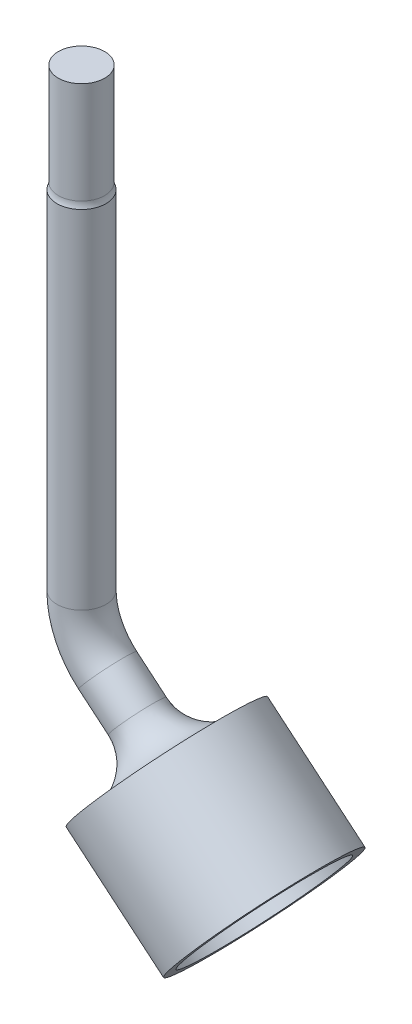
from build123d import *

# Parameters (mm, degrees)
SKETCH1_R           = 3.175
BOSS_EXTRUDE1_DEPTH = 40
SKETCH2_R           = 3.175
SKETCH5_R           = 11
BOSS_EXTRUDE2_DEPTH = 1.5
SKETCH4_R           = 11
SKETCH4_R_2         = 9.652
BOSS_EXTRUDE3_DEPTH = 15
SKETCH6_R           = 3
BOSS_EXTRUDE4_DEPTH = 14
FILLET1_R           = 2
FILLET2_R           = 5


with BuildPart() as part:
    # Sketch1 → Boss-Extrude1 (new body)
    with BuildSketch(Plane(origin=(0, 0, 0), x_dir=(1, 0, 0), z_dir=(0, 1, 0))):
        with Locations(Location((0, 0, 0), (0, 0, 270))):
            Circle(SKETCH1_R)
    extrude(amount=BOSS_EXTRUDE1_DEPTH)

    # Sweep1: sweep along a path in Sketch3
    with BuildLine(Plane.XY) as sweep1_path:
        Line((0, 0), (0, -5))
        ThreePointArc((0, -5), (0.892418328, -9.025438943), (3.402448018, -12.296573321))
        Line((3.402448018, -12.296573321), (11.062892449, -18.724449418))
    # Sketch2 → Sweep1 (sweep)
    with BuildSketch(Plane.XZ):
        Circle(SKETCH2_R)
    sweep(path=sweep1_path.line)

    # Sketch5 → Boss-Extrude2 (add)
    with BuildSketch(Plane(origin=(15.71196326, -13.183902576, 0), x_dir=(0, 0, -1), z_dir=(0.7660444431189796, -0.6427876096865375, 0))):
        with Locations(Location((0, -7.232670233, 0), (0, 0, 90))):
            Circle(SKETCH5_R)
    extrude(amount=BOSS_EXTRUDE2_DEPTH)

    # Sketch4 → Boss-Extrude3 (add)
    with BuildSketch(Plane(origin=(16.861029925, -14.148083991, 0), x_dir=(0, 0, -1), z_dir=(0.7660444431189796, -0.6427876096865375, 0))):
        with Locations(Location((0, -7.232670233, 0), (0, 0, 90))):
            Circle(SKETCH4_R)
        with Locations(Location((0, -7.232670233, 0), (0, 0, 90))):
            Circle(SKETCH4_R_2, mode=Mode.SUBTRACT)
    extrude(amount=BOSS_EXTRUDE3_DEPTH)

    # Sketch6 → Boss-Extrude4 (add)
    with BuildSketch(Plane(origin=(0, 40, 0), x_dir=(1, 0, 0), z_dir=(0, 1, 0))):
        with Locations(Location((0, 0, 0), (0, 0, 270))):
            Circle(SKETCH6_R)
    extrude(amount=BOSS_EXTRUDE4_DEPTH)

    # Fillet1
    # the kernel refuses this fillet: 2 mm, written as the material it adds along each edge
    with BuildSketch(Plane(origin=(0, 40, 0), x_dir=(0, 0, 1), z_dir=(-1, 0, 0))) as fillet1_piece_1:
        with BuildLine():
            CenterArc((5, 0.818153409), FILLET1_R, 180, 24.146847997)
            Line((3, 0.818153409), (2.96, 0.818153409))
            Line((2.96, 0.818153409), (2.96, 0))
            Line((2.96, 0), (3, -0.04))
            ThreePointArc((3, -0.04), (3.0875, -0.04), (3.1385, -0.016363068))
            Line((3.1385, -0.016363068), (3.175, 0))
        make_face()
    revolve(axis=Axis((0, 40, 0), (0, 1, 0)))

    # Fillet2
    fillet2_edges = [part.edges().sort_by_distance(p)[0] for p in [
        (9.022041788, -21.156640524, 0),
    ]]
    fillet(fillet2_edges, radius=FILLET2_R)


solid = part.part
